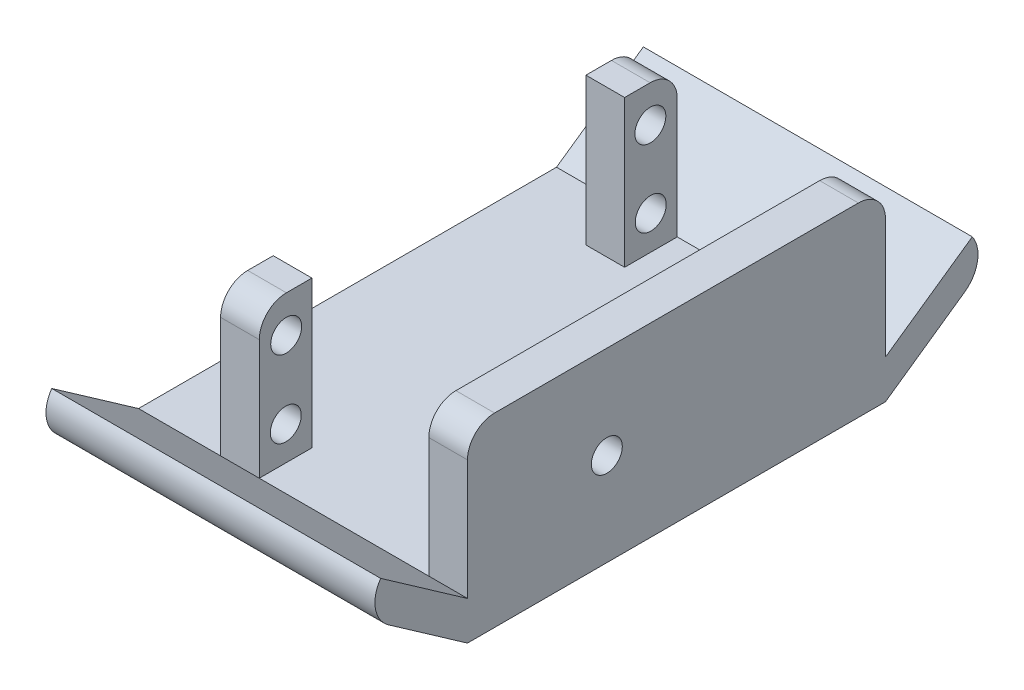
from build123d import *

# Parameters (mm, degrees)
SKETCH_OF_SERVO_MOTOR_W               = 42.5
SKETCH_OF_SERVO_MOTOR_H               = 54
EXTRUDE_BASE_OF_FOOT_DEPTH            = 5
POSITIONS_OF_FOOT_SIDES_W             = 5
POSITIONS_OF_FOOT_SIDES_H             = 54
POSITIONS_OF_FOOT_SIDES_H_2           = 6.8
EXTRUDE_SIDES_OF_FOOT_DEPTH           = 19
FILLET_TOP_EDGES_OF_SIDES_OF_FOOT_R   = 3.5
EXTRUDE_FOOT_LIPS_DEPTH               = 42.5
FILLET_FOOT_LIPS_R                    = 4.1
HOLE_DIMENSIONS_FOR_M4_BOLT_R         = 2
EXTRUDE_CUT_HOLE_FOR_M4_BOLT_DEPTH    = 5
CUT_EXTRUDE1_REACH                    = 77.278
DIMENSIONS_FOR_OUTSIDE_FOOT_M4_HOLE_R = 2


with BuildPart() as part:
    # Sketch of Servo Motor → Extrude Base of Foot (new body)
    with BuildSketch(Plane(origin=(0, 0, 0), x_dir=(1, 0, 0), z_dir=(0, 1, 0))):
        with Locations((10.65, -20.2)):
            Rectangle(SKETCH_OF_SERVO_MOTOR_W, SKETCH_OF_SERVO_MOTOR_H)
    extrude(amount=-EXTRUDE_BASE_OF_FOOT_DEPTH)

    # Positions of Foot Sides → Extrude Sides of Foot (add)
    with BuildSketch(Plane(origin=(0, 0, 0), x_dir=(1, 0, 0), z_dir=(0, 1, 0))):
        with Locations((29.4, -20.2)):
            Rectangle(POSITIONS_OF_FOOT_SIDES_W, POSITIONS_OF_FOOT_SIDES_H)
        with Locations((2.5, 3.4)):
            Rectangle(POSITIONS_OF_FOOT_SIDES_W, POSITIONS_OF_FOOT_SIDES_H_2)
        with Locations((2.5, -43.8)):
            Rectangle(POSITIONS_OF_FOOT_SIDES_W, POSITIONS_OF_FOOT_SIDES_H_2)
    extrude(amount=EXTRUDE_SIDES_OF_FOOT_DEPTH)

    # Fillet Top Edges of Sides of Foot
    fillet_top_edges_of_sides_of_foot_edges = [part.edges().sort_by_distance(p)[0] for p in [
        (2.5, 19, -6.8),
        (2.5, 19, 47.2),
        (29.4, 19, -6.8),
        (29.4, 19, 47.2),
    ]]
    fillet(fillet_top_edges_of_sides_of_foot_edges, radius=FILLET_TOP_EDGES_OF_SIDES_OF_FOOT_R)

    # Front and Back Foot Lips → Extrude Foot Lips (add, through all)
    with BuildSketch(Plane.ZY.offset(10.6)):
        Polygon((60.767406064, 4.5), (58.418174512, 7.855050358), (47.2, 0), (47.2, -5), align=None)
        Polygon((-6.8, 0), (-6.8, -5), (-20.367406064, 4.5), (-18.018174512, 7.855050358), align=None)
    extrude(amount=-EXTRUDE_FOOT_LIPS_DEPTH)

    # Fillet Foot Lips
    # the kernel refuses this fillet: 4.1 mm, written as the material it takes off along each edge
    with BuildSketch(Plane(origin=(-20.85, 4.5, 60.767406064), x_dir=(0, 0.8191520442889908, -0.5735764363510476), z_dir=(1, 0, 0)), Plane(origin=(-20.85, 4.5, -20.367406064), x_dir=(0, -0.5735764363510438, 0.8191520442889934), z_dir=(1, 0, 0))) as fillet_foot_lips_piece_1:
        with BuildLine():
            CenterArc((FILLET_FOOT_LIPS_R, -FILLET_FOOT_LIPS_R), FILLET_FOOT_LIPS_R, 90, 90)
            Line((0, -FILLET_FOOT_LIPS_R), (0, 0))
            Line((0, 0), (FILLET_FOOT_LIPS_R, 0))
        make_face()
    extrude(amount=63, mode=Mode.SUBTRACT)

    # Hole Dimensions for M4 Bolt → Extrude Cut Hole for M4 Bolt (cut)
    with BuildSketch(Plane.ZY):
        with Locations((-3.324953132, 14.258904835)):
            Circle(HOLE_DIMENSIONS_FOR_M4_BOLT_R)
        with Locations((-3.377058396, 4.358904835)):
            Circle(HOLE_DIMENSIONS_FOR_M4_BOLT_R)
        with Locations((43.724953132, 14.258904835)):
            Circle(HOLE_DIMENSIONS_FOR_M4_BOLT_R)
        with Locations((43.777058396, 4.358904835)):
            Circle(HOLE_DIMENSIONS_FOR_M4_BOLT_R)
    extrude(amount=-EXTRUDE_CUT_HOLE_FOR_M4_BOLT_DEPTH, mode=Mode.SUBTRACT)

    # Dimensions for Outside Foot M4 Hole → Cut-Extrude1 (cut, up to next)
    with BuildSketch(Plane(origin=(31.9, 0, 0), x_dir=(0, 0, -1), z_dir=(1, 0, 0)), mode=Mode.PRIVATE) as cut_extrude1_sk1:
        with Locations((-29.2, 7)):
            Circle(DIMENSIONS_FOR_OUTSIDE_FOOT_M4_HOLE_R)
    cut_extrude1_tool1 = extrude(cut_extrude1_sk1.sketch, amount=-CUT_EXTRUDE1_REACH, mode=Mode.PRIVATE) & part.part
    add(cut_extrude1_tool1.solids().sort_by_distance((31.9, 7, 29.2))[0], mode=Mode.SUBTRACT)


solid = part.part
